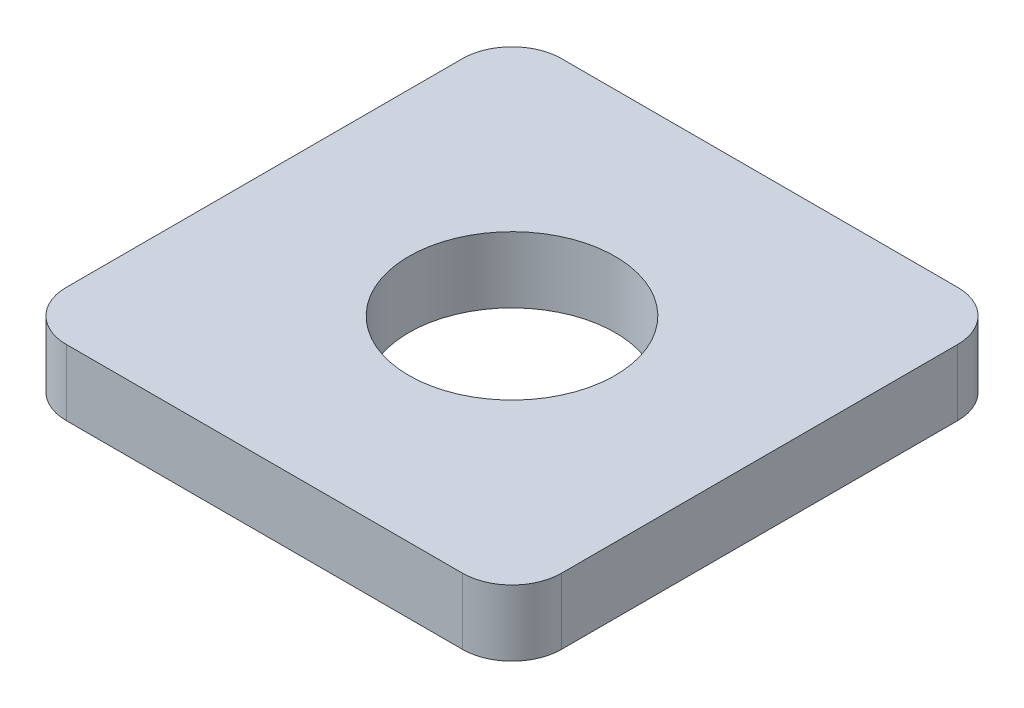
from build123d import *

# Parameters (mm, degrees)
SKETCH_1_R             = 6.25
SM_BASE_FLANGE_1_DEPTH = 4


# Sheet-metal steps are written as plain solids
with BuildPart() as part:
    # Sketch 1 → Базовая кромка1 (new body)
    with BuildSketch(Plane(origin=(0, 0, 0), x_dir=(1, 0, 0), z_dir=(0, 1, 0))):
        with BuildLine():
            Line((12, 15), (-12, 15))
            ThreePointArc((-12, 15), (-14.121320344, 14.121320344), (-15, 12))
            Line((-15, 12), (-15, -12))
            ThreePointArc((-15, -12), (-14.121320344, -14.121320344), (-12, -15))
            Line((-12, -15), (12, -15))
            ThreePointArc((12, -15), (14.121320344, -14.121320344), (15, -12))
            Line((15, -12), (15, 12))
            ThreePointArc((15, 12), (14.121320344, 14.121320344), (12, 15))
        make_face()
        with Locations(Location((0, 0, 0), (0, 0, 270))):
            Circle(SKETCH_1_R, mode=Mode.SUBTRACT)
    extrude(amount=-SM_BASE_FLANGE_1_DEPTH)


solid = part.part
